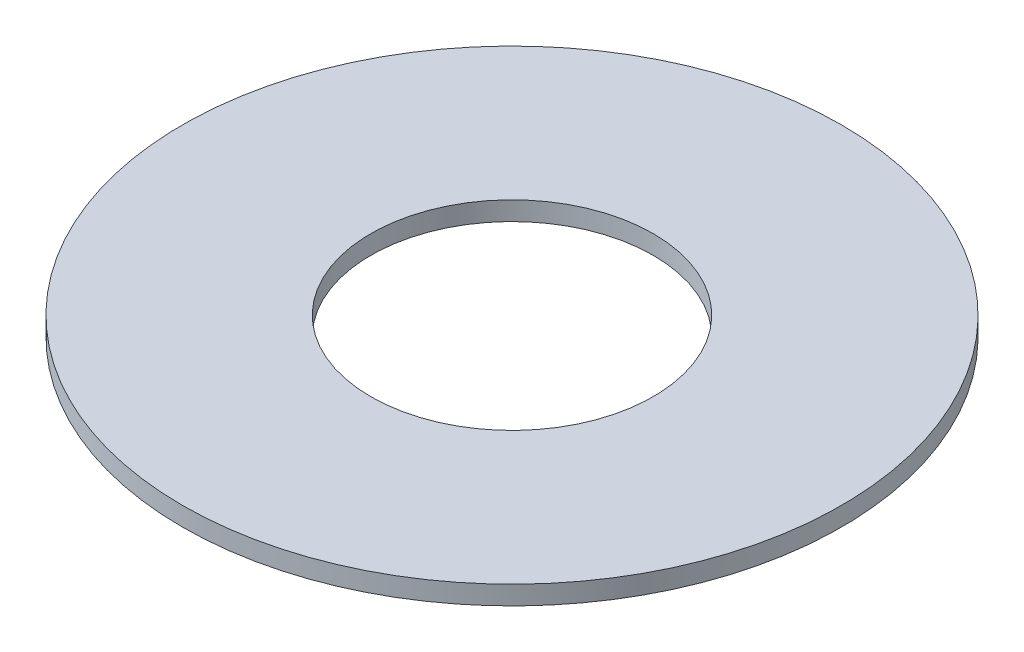
from build123d import *

# Parameters (mm, degrees)
SKETCH1_R           = 87.5
BOSS_EXTRUDE1_DEPTH = 5
SKETCH2_R           = 37.5
CUT_EXTRUDE1_DEPTH  = 124.844660765


with BuildPart() as part:
    # Sketch1 → Boss-Extrude1 (new body)
    with BuildSketch(Plane(origin=(0, 0, 0), x_dir=(1, 0, 0), z_dir=(0, 1, 0))):
        Circle(SKETCH1_R)
    extrude(amount=BOSS_EXTRUDE1_DEPTH)

    # Sketch2 → Cut-Extrude1 (cut, through all)
    with BuildSketch(Plane(origin=(0, 0, 0), x_dir=(1, 0, 0), z_dir=(0, 1, 0))):
        Circle(SKETCH2_R)
    extrude(amount=CUT_EXTRUDE1_DEPTH, mode=Mode.SUBTRACT)


solid = part.part
